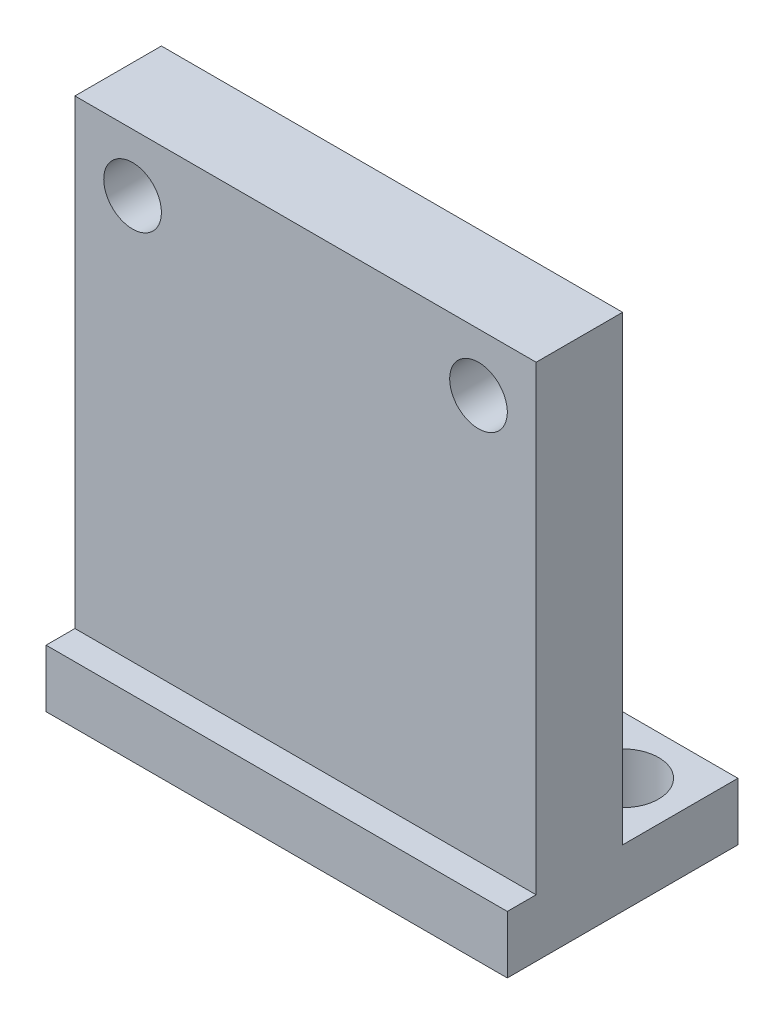
from build123d import *

# Parameters (mm, degrees)
SKETCH1_W           = 20.32
SKETCH1_H           = 22.86
BOSS_EXTRUDE1_DEPTH = 5.08
CUT_EXTRUDE1_REACH  = 33.005
SKETCH2_R           = 1.27
SKETCH3_W           = 20.32
SKETCH3_H           = 10.16
BOSS_EXTRUDE2_DEPTH = 2.54
SKETCH4_W           = 20.32
SKETCH4_H           = 20.32
CUT_EXTRUDE2_DEPTH  = 1.27
SKETCH5_R           = 1.5875
CUT_EXTRUDE3_DEPTH  = 2.54


with BuildPart() as part:
    # Sketch1 → Boss-Extrude1 (new body)
    with BuildSketch(Plane.XY):
        with Locations((10.16, 11.43)):
            Rectangle(SKETCH1_W, SKETCH1_H)
    extrude(amount=BOSS_EXTRUDE1_DEPTH)

    # Sketch2 → Cut-Extrude1 (cut, up to next)
    with BuildSketch(Plane.XY.offset(5.08), mode=Mode.PRIVATE) as cut_extrude1_sk1:
        with Locations((2.54, 20.32)):
            Circle(SKETCH2_R)
    cut_extrude1_tool1 = extrude(cut_extrude1_sk1.sketch, amount=-CUT_EXTRUDE1_REACH, mode=Mode.PRIVATE) & part.part
    # Sketch2 → Cut-Extrude1 (cut, up to next)
    with BuildSketch(Plane.XY.offset(5.08), mode=Mode.PRIVATE) as cut_extrude1_sk2:
        with Locations((17.78, 20.32)):
            Circle(SKETCH2_R)
    cut_extrude1_tool2 = extrude(cut_extrude1_sk2.sketch, amount=-CUT_EXTRUDE1_REACH, mode=Mode.PRIVATE) & part.part
    add(cut_extrude1_tool1.solids().sort_by_distance((2.54, 20.32, 5.08))[0], mode=Mode.SUBTRACT)
    add(cut_extrude1_tool2.solids().sort_by_distance((17.78, 20.32, 5.08))[0], mode=Mode.SUBTRACT)

    # Sketch3 → Boss-Extrude2 (add)
    with BuildSketch(Plane.XZ):
        with Locations((10.16, 0)):
            Rectangle(SKETCH3_W, SKETCH3_H)
    extrude(amount=-BOSS_EXTRUDE2_DEPTH)

    # Sketch4 → Cut-Extrude2 (cut)
    with BuildSketch(Plane.XY.offset(5.08)):
        with Locations((10.16, 12.7)):
            Rectangle(SKETCH4_W, SKETCH4_H)
    extrude(amount=-CUT_EXTRUDE2_DEPTH, mode=Mode.SUBTRACT)

    # Sketch5 → Cut-Extrude3 (cut)
    with BuildSketch(Plane(origin=(0, 2.54, 0), x_dir=(1, 0, 0), z_dir=(0, 1, 0))):
        with Locations((17.78, 2.54)):
            Circle(SKETCH5_R)
        with Locations((2.54, 2.54)):
            Circle(SKETCH5_R)
    extrude(amount=-CUT_EXTRUDE3_DEPTH, mode=Mode.SUBTRACT)


solid = part.part
